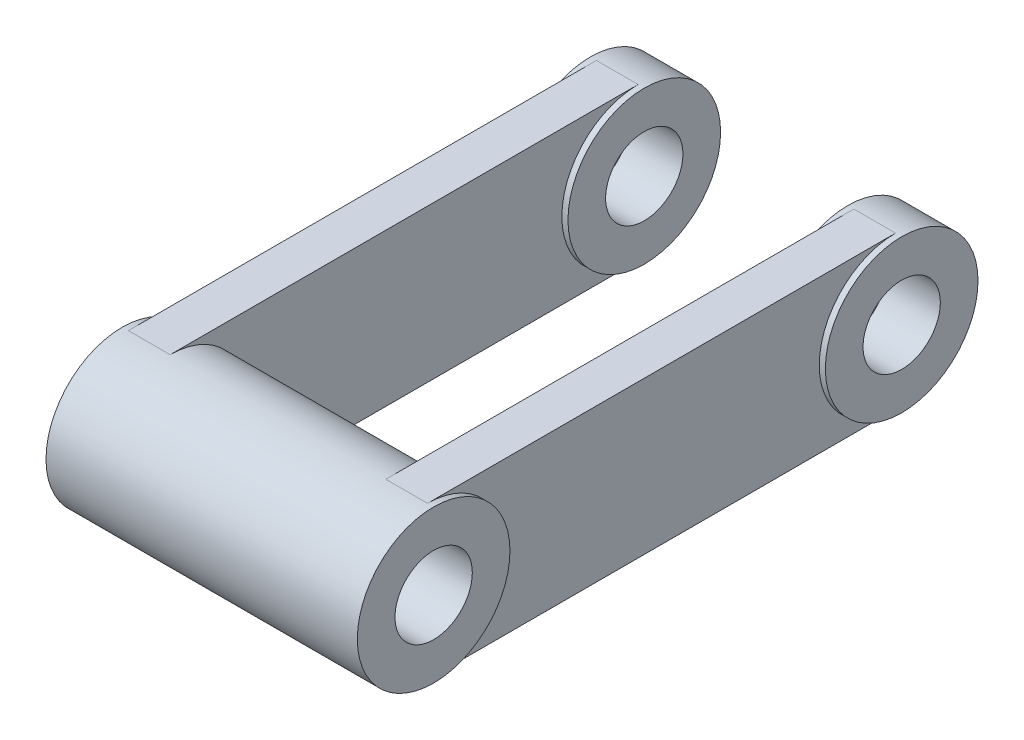
from build123d import *
from build123d.topology import SkipClean

# Parameters (mm, degrees)
SKETCH1_R           = 75
SKETCH1_R_2         = 38
BOSS_EXTRUDE1_DEPTH = 153
SKETCH3_R           = 38
BOSS_EXTRUDE2_DEPTH = 20.5
SKETCH5_R           = 75
SKETCH5_R_2         = 38
BOSS_EXTRUDE3_DEPTH = 26.5


with BuildPart() as part:
    # Sketch1 → Boss-Extrude1 (new, symmetric)
    with BuildSketch(Plane(origin=(0, 0, 0), x_dir=(0, 0, -1), z_dir=(1, 0, 0))):
        Circle(SKETCH1_R)
        Circle(SKETCH1_R_2, mode=Mode.SUBTRACT)
    extrude(amount=BOSS_EXTRUDE1_DEPTH, both=True)

    # Sketch3 → Boss-Extrude2 (add, symmetric)
    with BuildSketch(Plane(origin=(126.5, 0, 0), x_dir=(0, 0, -1), z_dir=(1, 0, 0))):
        with BuildLine():
            Line((0, 75), (460, 75))
            ThreePointArc((460, 75), (535, 0), (460, -75))
            Line((460, -75), (0, -75))
            ThreePointArc((0, -75), (-75, 0), (0, 75))
        make_face()
        with Locations((460, 0)):
            Circle(SKETCH3_R, mode=Mode.SUBTRACT)
        Circle(SKETCH3_R, mode=Mode.SUBTRACT)
    boss_extrude2 = extrude(amount=BOSS_EXTRUDE2_DEPTH, both=True)

    # Sketch5 → Boss-Extrude3 (add, symmetric)
    with SkipClean():  # the faces are left unmerged after this step: merging them gives an invalid solid
        with BuildSketch(Plane(origin=(126.5, 0, 0), x_dir=(0, 0, -1), z_dir=(1, 0, 0))):
            with Locations((460, 0)):
                Circle(SKETCH5_R)
            with Locations((460, 0)):
                Circle(SKETCH5_R_2, mode=Mode.SUBTRACT)
        boss_extrude3 = extrude(amount=BOSS_EXTRUDE3_DEPTH, both=True)
    add(part.part.scale(1), mode=Mode.REPLACE)  # the faces are merged on a copy

    # Mirror3: Boss-Extrude2, Boss-Extrude3 across plane
    add(boss_extrude2.mirror(Plane(origin=(0, 0, 0), x_dir=(0, 0, 1), z_dir=(1, 0, 0))))
    add(boss_extrude3.mirror(Plane(origin=(0, 0, 0), x_dir=(0, 0, 1), z_dir=(1, 0, 0))))


solid = part.part
